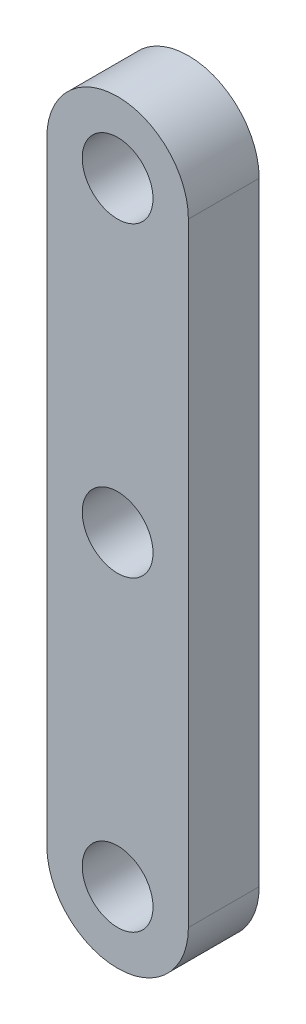
from build123d import *

# Parameters (mm, degrees)
SKETCH1_R           = 1.5
BOSS_EXTRUDE1_DEPTH = 3


with BuildPart() as part:
    # Sketch1 → Boss-Extrude1 (new body)
    with BuildSketch(Plane.XY):
        with BuildLine():
            Line((3, 13), (3, -13))
            ThreePointArc((3, -13), (0, -16), (-3, -13))
            Line((-3, -13), (-3, 13))
            ThreePointArc((-3, 13), (0, 16), (3, 13))
        make_face()
        with Locations((0, 13)):
            Circle(SKETCH1_R, mode=Mode.SUBTRACT)
        with Locations((0, -13)):
            Circle(SKETCH1_R, mode=Mode.SUBTRACT)
        Circle(SKETCH1_R, mode=Mode.SUBTRACT)
    extrude(amount=BOSS_EXTRUDE1_DEPTH)


solid = part.part
